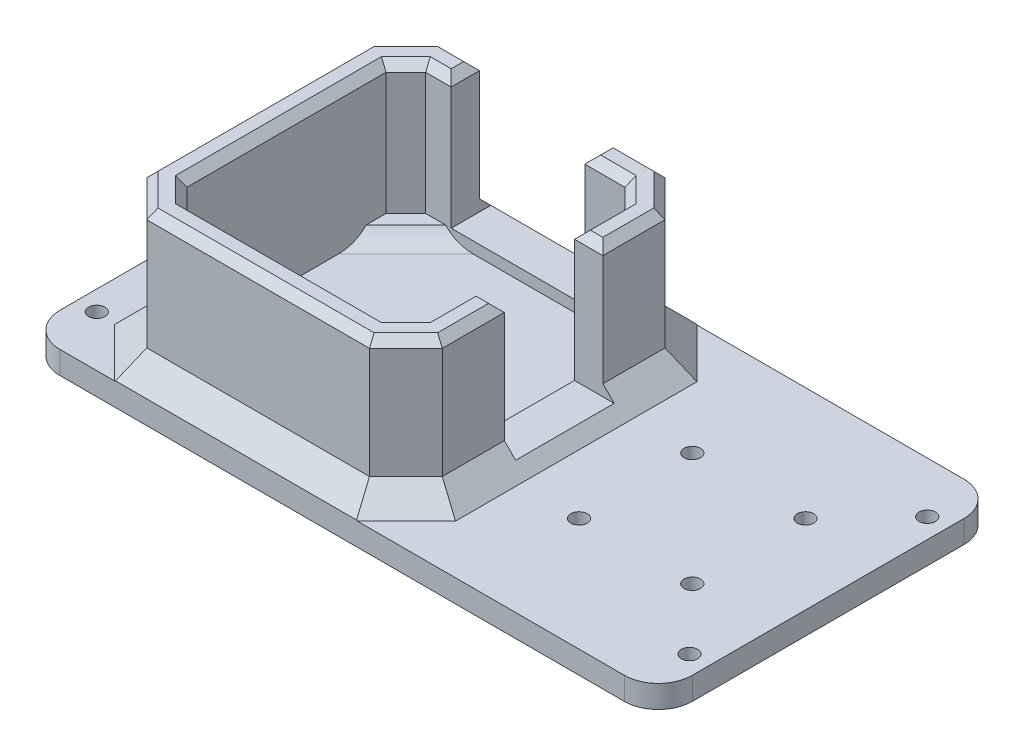
from build123d import *

# Parameters (mm, degrees)
SKETCH_1_W          = 111.7
SKETCH_1_H          = 60
SKETCH_1_R          = 1.45
EXTRUDE_1_DEPTH     = 4
EXTRUDE_2_DEPTH     = 25
SKETCH_4_W          = 23.6
SKETCH_4_H          = 5
SKETCH_4_W_2        = 5
SKETCH_4_H_2        = 17.4
EXTRUDE_3_DEPTH     = 2
CHAMFER_1_SIZE      = 4
FILLET_1_R          = 6
SKETCH_5_R          = 1.45
CUT_EXTRUDE_1_DEPTH = 69.148532633
CHAMFER_2_SIZE      = 1.4
FILLET_2_R          = 4


with BuildPart() as part:
    # 草图1 → 凸台-拉伸1 (new body)
    with BuildSketch(Plane(origin=(0, 0, 0), x_dir=(1, 0, 0), z_dir=(0, 1, 0))):
        Rectangle(SKETCH_1_W, SKETCH_1_H)
        with Locations(Location((-52.35, 21, 0), (0, 0, 270))):
            Circle(SKETCH_1_R, mode=Mode.SUBTRACT)
        with Locations(Location((52.35, 21, 0), (0, 0, 270))):
            Circle(SKETCH_1_R, mode=Mode.SUBTRACT)
        with Locations(Location((52.35, -21, 0), (0, 0, 270))):
            Circle(SKETCH_1_R, mode=Mode.SUBTRACT)
        with Locations(Location((-52.35, -21, 0), (0, 0, 270))):
            Circle(SKETCH_1_R, mode=Mode.SUBTRACT)
    extrude(amount=EXTRUDE_1_DEPTH)

    # 草图3 → 凸台-拉伸2 (add)
    with BuildSketch(Plane(origin=(0, 4, 0), x_dir=(1, 0, 0), z_dir=(0, 1, 0))):
        Polygon((-36.35, 21.1), (-31.839090409, 21.1), (-31.839090409, 26.1), (-38.421067812, 26.1), (-44.85, 19.671067812), (-44.85, -19.671067812), (-38.421067812, -26.1), (0.921067812, -26.1), (7.35, -19.671067812), (7.35, -8.7), (2.35, -8.7), (2.35, -17.6), (-1.15, -21.1), (-36.35, -21.1), (-39.85, -17.6), (-39.85, 17.6), align=None)
        Polygon((-8.239090409, 21.1), (-1.15, 21.1), (2.35, 17.6), (2.35, 8.7), (7.35, 8.7), (7.35, 19.671067812), (0.921067812, 26.1), (-8.239090409, 26.1), align=None)
    extrude(amount=EXTRUDE_2_DEPTH)

    # 草图4 → 凸台-拉伸3 (add)
    with BuildSketch(Plane(origin=(0, 4, 0), x_dir=(1, 0, 0), z_dir=(0, 1, 0))):
        with Locations((-20.039090409, 23.6)):
            Rectangle(SKETCH_4_W, SKETCH_4_H)
        with Locations((4.85, 0)):
            Rectangle(SKETCH_4_W_2, SKETCH_4_H_2)
        Polygon((-39.85, 17.6), (-39.85, 14.028932188), (-32.778932188, 21.1), (-36.35, 21.1), align=None)
        Polygon((-4.721067812, 21.1), (2.35, 14.028932188), (2.35, 17.6), (-1.15, 21.1), align=None)
        Polygon((2.35, -17.6), (2.35, -14.028932188), (-4.721067812, -21.1), (-1.15, -21.1), align=None)
        Polygon((-36.35, -21.1), (-32.778932188, -21.1), (-39.85, -14.028932188), (-39.85, -17.6), align=None)
    extrude(amount=EXTRUDE_3_DEPTH)

    # 倒角1
    # the kernel refuses this chamfer: 4 mm, written as the material it adds along each edge
    with BuildSketch(Plane(origin=(-31.147249892, 4, -33.373817919), x_dir=(-0.7071067811865474, 0, -0.7071067811865478), z_dir=(-0.7071067811865478, 0, 0.7071067811865474))) as chamfer_1_piece_1_section:
        Polygon((CHAMFER_1_SIZE, 0), (0, -CHAMFER_1_SIZE), (0, 0), align=None)
    chamfer_1_piece_1 = extrude(amount=29.665346996, mode=Mode.PRIVATE)
    chamfer_1_piece_1 = split(chamfer_1_piece_1, bisect_by=Plane(origin=(-31.147249892, 4, -30), z_dir=(0, 0, 1)), keep=Keep.TOP, mode=Mode.PRIVATE)
    chamfer_1_piece_1 = split(chamfer_1_piece_1, bisect_by=Plane(origin=(-39.998624946, 12.851375054, -33.373817919), z_dir=(0.7071067811865476, -0.7071067811865476, 0)), keep=Keep.TOP, mode=Mode.PRIVATE)
    chamfer_1_piece_1 = split(chamfer_1_piece_1, bisect_by=Plane(origin=(-31.147249892, 2.36309104, -31.73690896), z_dir=(0, -0.7071067811865476, 0.7071067811865476)), keep=Keep.TOP, mode=Mode.PRIVATE)
    add(chamfer_1_piece_1)
    with BuildSketch(Plane(origin=(-48.707799764, 4, -26.1), x_dir=(0, 0, -1), z_dir=(1, 0, 0))) as chamfer_1_piece_2_section:
        Polygon((CHAMFER_1_SIZE, 0), (0, CHAMFER_1_SIZE), (0, 0), align=None)
    chamfer_1_piece_2 = extrude(amount=59.915599527, mode=Mode.PRIVATE)
    chamfer_1_piece_2 = split(chamfer_1_piece_2, bisect_by=Plane(origin=(-48.707799764, 6, -26.1), z_dir=(0, -1, 0)), keep=Keep.TOP, mode=Mode.PRIVATE)
    chamfer_1_piece_2 = split(chamfer_1_piece_2, bisect_by=Plane(origin=(-48.707799764, 4, -30), z_dir=(0, 0, 1)), keep=Keep.TOP, mode=Mode.PRIVATE)
    chamfer_1_piece_2 = split(chamfer_1_piece_2, bisect_by=Plane(origin=(-34.886369307, 23.546454403, -39.921430456), z_dir=(-0.4999999999999999, -0.7071067811865478, 0.49999999999999967)), keep=Keep.TOP, mode=Mode.PRIVATE)
    chamfer_1_piece_2 = split(chamfer_1_piece_2, bisect_by=Plane(origin=(-47.550330338, 2.36309104, -24.942530574), z_dir=(0.4999999999999996, -0.7071067811865479, 0.4999999999999999)), keep=Keep.TOP, mode=Mode.PRIVATE)
    add(chamfer_1_piece_2)
    with BuildSketch(Plane(origin=(-48.707799764, 4, -26.1), x_dir=(0, 0, -1), z_dir=(1, 0, 0))) as chamfer_1_piece_3_section:
        Polygon((CHAMFER_1_SIZE, 0), (0, CHAMFER_1_SIZE), (0, 0), align=None)
    chamfer_1_piece_3 = extrude(amount=59.915599527, mode=Mode.PRIVATE)
    chamfer_1_piece_3 = split(chamfer_1_piece_3, bisect_by=Plane(origin=(-31.839090409, 4, -26.1), z_dir=(-1, 0, 0)), keep=Keep.TOP, mode=Mode.PRIVATE)
    chamfer_1_piece_3 = split(chamfer_1_piece_3, bisect_by=Plane(origin=(-48.707799764, 4, -30), z_dir=(0, 0, 1)), keep=Keep.TOP, mode=Mode.PRIVATE)
    chamfer_1_piece_3 = split(chamfer_1_piece_3, bisect_by=Plane(origin=(-47.550330338, 2.36309104, -24.942530574), z_dir=(0.4999999999999996, -0.7071067811865479, 0.4999999999999999)), keep=Keep.TOP, mode=Mode.PRIVATE)
    add(chamfer_1_piece_3)
    with BuildSketch(Plane(origin=(-48.707799764, 4, -26.1), x_dir=(0, 0, -1), z_dir=(1, 0, 0))) as chamfer_1_piece_4_section:
        Polygon((CHAMFER_1_SIZE, 0), (0, CHAMFER_1_SIZE), (0, 0), align=None)
    chamfer_1_piece_4 = extrude(amount=59.915599527, mode=Mode.PRIVATE)
    chamfer_1_piece_4 = split(chamfer_1_piece_4, bisect_by=Plane(origin=(-8.239090409, 4, -26.1), z_dir=(1, 0, 0)), keep=Keep.TOP, mode=Mode.PRIVATE)
    chamfer_1_piece_4 = split(chamfer_1_piece_4, bisect_by=Plane(origin=(-48.707799764, 4, -30), z_dir=(0, 0, 1)), keep=Keep.TOP, mode=Mode.PRIVATE)
    chamfer_1_piece_4 = split(chamfer_1_piece_4, bisect_by=Plane(origin=(-34.886369307, 23.546454403, -39.921430456), z_dir=(-0.4999999999999999, -0.7071067811865478, 0.49999999999999967)), keep=Keep.TOP, mode=Mode.PRIVATE)
    add(chamfer_1_piece_4)
    with BuildSketch(Plane(origin=(14.623817919, 4, -12.397249892), x_dir=(0.7071067811865477, 0, -0.7071067811865475), z_dir=(-0.7071067811865475, 0, -0.7071067811865477))) as chamfer_1_piece_5_section:
        Polygon((CHAMFER_1_SIZE, 0), (0, -CHAMFER_1_SIZE), (0, 0), align=None)
    chamfer_1_piece_5 = extrude(amount=29.665346996, mode=Mode.PRIVATE)
    chamfer_1_piece_5 = split(chamfer_1_piece_5, bisect_by=Plane(origin=(14.623817919, 4, -30), z_dir=(0, 0, 1)), keep=Keep.TOP, mode=Mode.PRIVATE)
    chamfer_1_piece_5 = split(chamfer_1_piece_5, bisect_by=Plane(origin=(12.98690896, 2.36309104, -12.397249892), z_dir=(-0.7071067811865476, -0.7071067811865476, 0)), keep=Keep.TOP, mode=Mode.PRIVATE)
    chamfer_1_piece_5 = split(chamfer_1_piece_5, bisect_by=Plane(origin=(14.623817919, 12.851375054, -21.248624946), z_dir=(0, -0.7071067811865476, 0.7071067811865476)), keep=Keep.TOP, mode=Mode.PRIVATE)
    add(chamfer_1_piece_5)
    with BuildSketch(Plane(origin=(-44.85, 4, -29.957799764), x_dir=(-1, 0, 0), z_dir=(0, 0, 1))) as chamfer_1_piece_6_section:
        Polygon((CHAMFER_1_SIZE, 0), (0, -CHAMFER_1_SIZE), (0, 0), align=None)
    chamfer_1_piece_6 = extrude(amount=59.915599527, mode=Mode.PRIVATE)
    chamfer_1_piece_6 = split(chamfer_1_piece_6, bisect_by=Plane(origin=(-58.671430456, 23.546454403, -16.136369307), z_dir=(0.5000000000000001, -0.7071067811865477, -0.5000000000000001)), keep=Keep.TOP, mode=Mode.PRIVATE)
    chamfer_1_piece_6 = split(chamfer_1_piece_6, bisect_by=Plane(origin=(-43.692530574, 2.36309104, -28.800330338), z_dir=(0.4999999999999996, -0.7071067811865479, 0.4999999999999999)), keep=Keep.TOP, mode=Mode.PRIVATE)
    add(chamfer_1_piece_6)
    with BuildSketch(Plane(origin=(-52.123817919, 4, 12.397249892), x_dir=(-0.7071067811865476, 0, 0.7071067811865476), z_dir=(0.7071067811865476, 0, 0.7071067811865476))) as chamfer_1_piece_7_section:
        Polygon((CHAMFER_1_SIZE, 0), (0, -CHAMFER_1_SIZE), (0, 0), align=None)
    chamfer_1_piece_7 = extrude(amount=29.665346996, mode=Mode.PRIVATE)
    chamfer_1_piece_7 = split(chamfer_1_piece_7, bisect_by=Plane(origin=(-52.123817919, 4, 30), z_dir=(0, 0, -1)), keep=Keep.TOP, mode=Mode.PRIVATE)
    chamfer_1_piece_7 = split(chamfer_1_piece_7, bisect_by=Plane(origin=(-52.123817919, 12.851375054, 21.248624946), z_dir=(0, -0.7071067811865472, -0.7071067811865479)), keep=Keep.TOP, mode=Mode.PRIVATE)
    chamfer_1_piece_7 = split(chamfer_1_piece_7, bisect_by=Plane(origin=(-50.48690896, 2.36309104, 12.397249892), z_dir=(0.7071067811865476, -0.7071067811865476, 0)), keep=Keep.TOP, mode=Mode.PRIVATE)
    add(chamfer_1_piece_7)
    with BuildSketch(Plane(origin=(7.35, 4, -29.957799764), x_dir=(1, 0, 0), z_dir=(0, 0, 1))) as chamfer_1_piece_8_section:
        Polygon((CHAMFER_1_SIZE, 0), (0, CHAMFER_1_SIZE), (0, 0), align=None)
    chamfer_1_piece_8 = extrude(amount=59.915599527, mode=Mode.PRIVATE)
    chamfer_1_piece_8 = split(chamfer_1_piece_8, bisect_by=Plane(origin=(7.35, 6, -29.957799764), z_dir=(0, -1, 0)), keep=Keep.TOP, mode=Mode.PRIVATE)
    chamfer_1_piece_8 = split(chamfer_1_piece_8, bisect_by=Plane(origin=(6.192530574, 2.36309104, -28.800330338), z_dir=(-0.4999999999999999, -0.7071067811865478, 0.49999999999999967)), keep=Keep.TOP, mode=Mode.PRIVATE)
    chamfer_1_piece_8 = split(chamfer_1_piece_8, bisect_by=Plane(origin=(21.171430456, 23.546454403, -16.136369307), z_dir=(-0.5000000000000004, -0.7071067811865477, -0.4999999999999993)), keep=Keep.TOP, mode=Mode.PRIVATE)
    add(chamfer_1_piece_8)
    with BuildSketch(Plane(origin=(7.35, 4, -29.957799764), x_dir=(1, 0, 0), z_dir=(0, 0, 1))) as chamfer_1_piece_9_section:
        Polygon((CHAMFER_1_SIZE, 0), (0, CHAMFER_1_SIZE), (0, 0), align=None)
    chamfer_1_piece_9 = extrude(amount=59.915599527, mode=Mode.PRIVATE)
    chamfer_1_piece_9 = split(chamfer_1_piece_9, bisect_by=Plane(origin=(7.35, 4, -8.7), z_dir=(0, 0, -1)), keep=Keep.TOP, mode=Mode.PRIVATE)
    chamfer_1_piece_9 = split(chamfer_1_piece_9, bisect_by=Plane(origin=(6.192530574, 2.36309104, -28.800330338), z_dir=(-0.4999999999999999, -0.7071067811865478, 0.49999999999999967)), keep=Keep.TOP, mode=Mode.PRIVATE)
    add(chamfer_1_piece_9)
    with BuildSketch(Plane(origin=(7.35, 4, -29.957799764), x_dir=(1, 0, 0), z_dir=(0, 0, 1))) as chamfer_1_piece_10_section:
        Polygon((CHAMFER_1_SIZE, 0), (0, CHAMFER_1_SIZE), (0, 0), align=None)
    chamfer_1_piece_10 = extrude(amount=59.915599527, mode=Mode.PRIVATE)
    chamfer_1_piece_10 = split(chamfer_1_piece_10, bisect_by=Plane(origin=(7.35, 4, 8.7), z_dir=(0, 0, 1)), keep=Keep.TOP, mode=Mode.PRIVATE)
    chamfer_1_piece_10 = split(chamfer_1_piece_10, bisect_by=Plane(origin=(21.171430456, 23.546454403, -16.136369307), z_dir=(-0.5000000000000004, -0.7071067811865477, -0.4999999999999993)), keep=Keep.TOP, mode=Mode.PRIVATE)
    add(chamfer_1_piece_10)
    with BuildSketch(Plane(origin=(-6.352750108, 4, 33.373817919), x_dir=(0.7071067811865483, 0, 0.7071067811865468), z_dir=(0.7071067811865467, 0, -0.7071067811865483))) as chamfer_1_piece_11_section:
        Polygon((CHAMFER_1_SIZE, 0), (0, -CHAMFER_1_SIZE), (0, 0), align=None)
    chamfer_1_piece_11 = extrude(amount=29.665346996, mode=Mode.PRIVATE)
    chamfer_1_piece_11 = split(chamfer_1_piece_11, bisect_by=Plane(origin=(-6.352750108, 4, 30), z_dir=(0, 0, -1)), keep=Keep.TOP, mode=Mode.PRIVATE)
    chamfer_1_piece_11 = split(chamfer_1_piece_11, bisect_by=Plane(origin=(2.498624946, 12.851375054, 33.373817919), z_dir=(-0.7071067811865476, -0.7071067811865476, 0)), keep=Keep.TOP, mode=Mode.PRIVATE)
    chamfer_1_piece_11 = split(chamfer_1_piece_11, bisect_by=Plane(origin=(-6.352750108, 2.36309104, 31.73690896), z_dir=(0, -0.7071067811865472, -0.7071067811865479)), keep=Keep.TOP, mode=Mode.PRIVATE)
    add(chamfer_1_piece_11)
    with BuildSketch(Plane(origin=(-48.707799764, 4, 26.1), x_dir=(0, 0, 1), z_dir=(1, 0, 0))) as chamfer_1_piece_12_section:
        Polygon((CHAMFER_1_SIZE, 0), (0, -CHAMFER_1_SIZE), (0, 0), align=None)
    chamfer_1_piece_12 = extrude(amount=59.915599527, mode=Mode.PRIVATE)
    chamfer_1_piece_12 = split(chamfer_1_piece_12, bisect_by=Plane(origin=(-48.707799764, 4, 30), z_dir=(0, 0, -1)), keep=Keep.TOP, mode=Mode.PRIVATE)
    chamfer_1_piece_12 = split(chamfer_1_piece_12, bisect_by=Plane(origin=(-34.886369307, 23.546454403, 39.921430456), z_dir=(-0.5000000000000004, -0.7071067811865477, -0.4999999999999993)), keep=Keep.TOP, mode=Mode.PRIVATE)
    chamfer_1_piece_12 = split(chamfer_1_piece_12, bisect_by=Plane(origin=(-47.550330338, 2.36309104, 24.942530574), z_dir=(0.5000000000000001, -0.7071067811865477, -0.5000000000000001)), keep=Keep.TOP, mode=Mode.PRIVATE)
    add(chamfer_1_piece_12)

    # 圆角1
    fillet_1_edges = [part.edges().sort_by_distance(p)[0] for p in [
        (55.85, 2, 30),
        (-55.85, 2, 30),
        (-55.85, 2, -30),
        (55.85, 2, -30),
    ]]
    fillet(fillet_1_edges, radius=FILLET_1_R)

    # 草图5 → 切除-拉伸1 (cut, through all)
    with BuildSketch(Plane(origin=(0, 4, 0), x_dir=(1, 0, 0), z_dir=(0, 1, 0))):
        with Locations(Location((21.85, 10, 0), (0, 0, 270))):
            Circle(SKETCH_5_R)
        with Locations(Location((41.85, 10, 0), (0, 0, 270))):
            Circle(SKETCH_5_R)
        with Locations(Location((41.85, -10, 0), (0, 0, 90))):
            Circle(SKETCH_5_R)
        with Locations(Location((21.85, -10, 0), (0, 0, 90))):
            Circle(SKETCH_5_R)
    extrude(amount=-CUT_EXTRUDE_1_DEPTH, mode=Mode.SUBTRACT)

    # 倒角2
    chamfer_2_edges = [part.edges().sort_by_distance(p)[0] for p in [
        (4.85, 29, 8.7),
        (0.6, 29, 19.35),
        (-18.75, 29, 21.1),
        (-38.1, 29, 19.35),
        (-39.85, 29, 0),
        (-35.130079111, 29, -26.1),
        (-41.635533906, 29, -22.885533906),
        (7.35, 29, 14.185533906),
        (2.35, 29, 13.15),
        (-38.1, 29, -19.35),
        (-34.094545205, 29, -21.1),
        (-31.839090409, 29, -23.6),
        (-44.85, 29, 0),
        (-41.635533906, 29, 22.885533906),
        (-18.75, 29, 26.1),
        (4.135533906, 29, 22.885533906),
        (7.35, 29, -14.185533906),
        (4.135533906, 29, -22.885533906),
        (-3.659011299, 29, -26.1),
        (-8.239090409, 29, -23.6),
        (2.35, 29, -13.15),
        (4.85, 29, -8.7),
        (-4.694545205, 29, -21.1),
        (0.6, 29, -19.35),
    ]]
    chamfer(chamfer_2_edges, length=CHAMFER_2_SIZE)

    # 圆角2
    # the kernel refuses this fillet: 4 mm, written as the material it adds along each edge
    with BuildSketch(Plane(origin=(-26.655207831, 4, 27.223724357), x_dir=(0.7071067811865476, 0, -0.7071067811865476), z_dir=(-0.7071067811865476, 0, -0.7071067811865476)), Plane(origin=(-45.973724357, 4, -7.905207831), x_dir=(0.7071067811865481, 0, 0.707106781186547), z_dir=(0.707106781186547, 0, -0.707106781186548)), Plane(origin=(-10.844792169, 4, -27.223724357), x_dir=(-0.7071067811865477, 0, 0.7071067811865475), z_dir=(0.7071067811865475, 0, 0.7071067811865476))) as fillet_2_piece_1:
        with BuildLine():
            CenterArc((3.464101615, -4), FILLET_2_R, 90, 60)
            Line((0, -2), (-0.069282032, -1.96))
            ThreePointArc((-0.069282032, -1.96), (-0.08, -1), (-0.08, 0))
            Line((-0.08, 0), (0, 0.08))
            Line((0, 0.08), (3.464101615, 0.08))
            Line((3.464101615, 0.08), (3.464101615, 0))
        make_face()
    extrude(amount=27.320508076)
    with BuildSketch(Plane(origin=(8.473724357, 4, 7.905207831), x_dir=(0, 1, 0), z_dir=(-0.7071067811865462, 0, 0.7071067811865488))) as fillet_2_piece_2:
        with BuildLine():
            CenterArc((4, 3.464101615), FILLET_2_R, 180, 60)
            Line((0, 3.464101615), (-0.08, 3.464101615))
            Line((-0.08, 3.464101615), (-0.08, 0))
            Line((-0.08, 0), (0, -0.08))
            ThreePointArc((0, -0.08), (1, -0.08), (1.96, -0.069282032))
            Line((1.96, -0.069282032), (2, 0))
        make_face()
    extrude(amount=27.320508076)


solid = part.part
